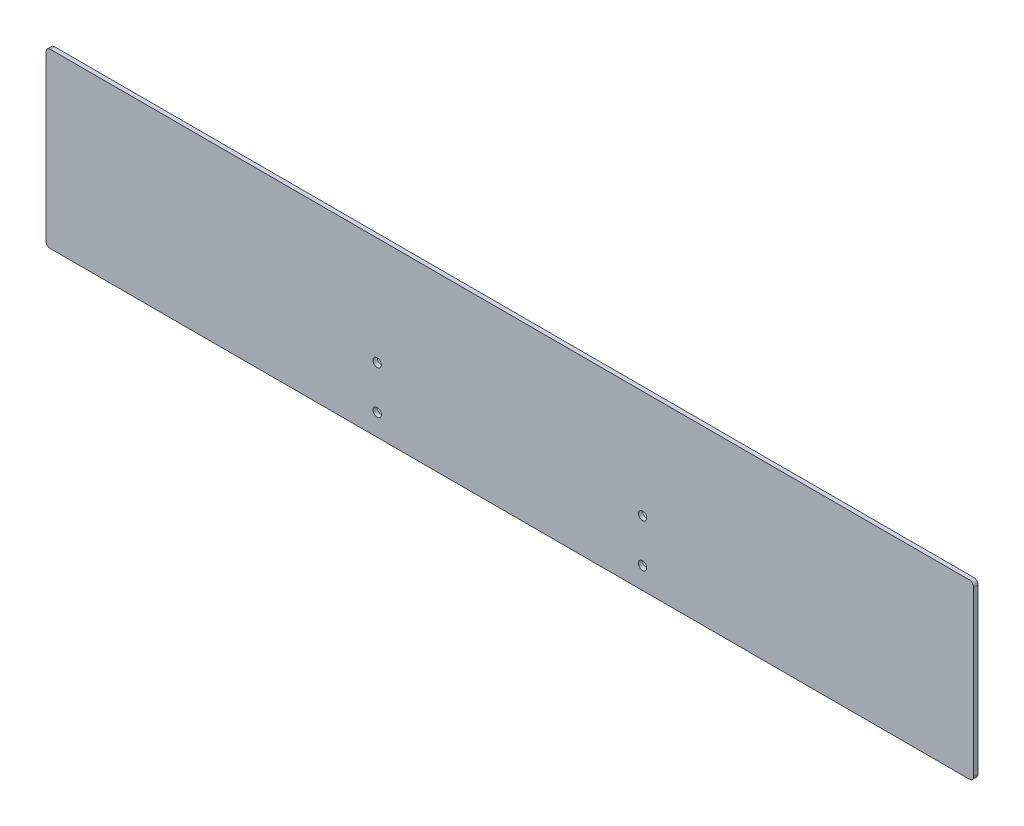
from build123d import *

# Parameters (mm, degrees)
SKETCH1_W           = 430
SKETCH1_H           = 80
SKETCH1_R           = 1.95
BOSS_EXTRUDE1_DEPTH = 2
FILLET1_R           = 2


with BuildPart() as part:
    # Sketch1 → Boss-Extrude1 (new body)
    with BuildSketch(Plane.XY):
        with Locations((-141.905896291, -4.296482412)):
            Rectangle(SKETCH1_W, SKETCH1_H)
        with Locations((-80.405896291, -14.296482412)):
            Circle(SKETCH1_R, mode=Mode.SUBTRACT)
        with Locations((-80.405896291, -34.296482412)):
            Circle(SKETCH1_R, mode=Mode.SUBTRACT)
        with Locations((-203.405896291, -14.296482412)):
            Circle(SKETCH1_R, mode=Mode.SUBTRACT)
        with Locations((-203.405896291, -34.296482412)):
            Circle(SKETCH1_R, mode=Mode.SUBTRACT)
    extrude(amount=BOSS_EXTRUDE1_DEPTH)

    # Fillet1
    fillet1_edges = [part.edges().sort_by_distance(p)[0] for p in [
        (73.094103709, 35.703517588, 1),
        (73.094103709, -44.296482412, 1),
        (-356.905896291, -44.296482412, 1),
        (-356.905896291, 35.703517588, 1),
    ]]
    fillet(fillet1_edges, radius=FILLET1_R)


solid = part.part
